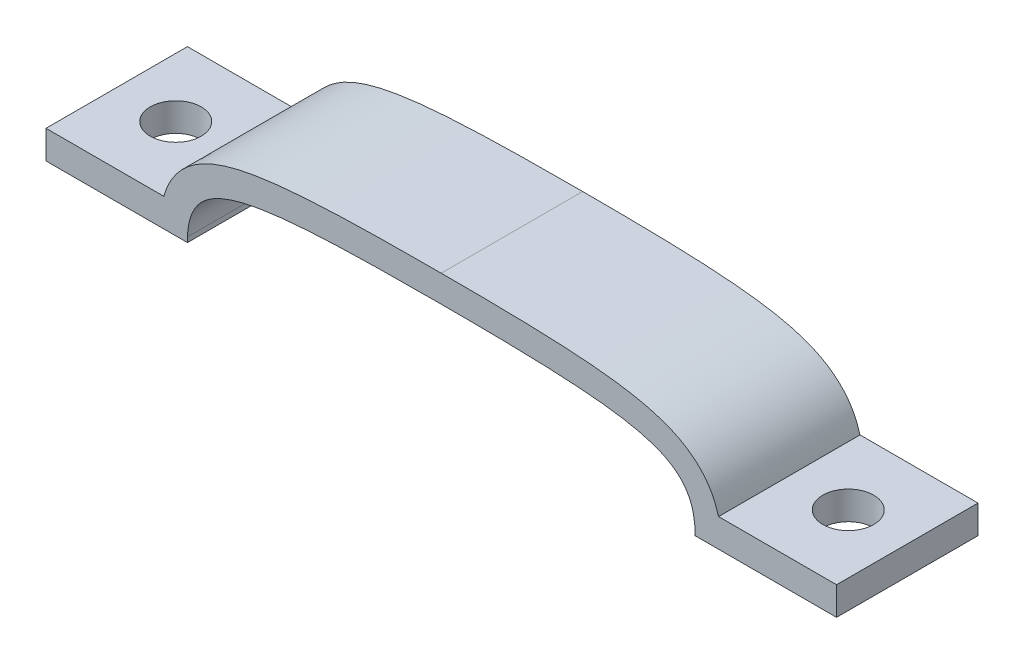
from build123d import *

# Parameters (mm, degrees)
BOSS_EXTRUDE1_DEPTH  = 10
M3_CLEARANCE_HOLE1_D = 3.6


with BuildPart() as part:
    # Sketch1 → Boss-Extrude1 (new body)
    with BuildSketch(Plane.XY):
        with BuildLine():
            Line((-60.071865843, 158.086868585), (-60.071865843, 158.433944586))
            add(Edge.make_bspline(
                [(-42.129226337, 163.286859626), (-43.810516811, 163.286860342), (-46.346669536, 163.273840815), (-49.670813728, 163.182542922), (-52.157685802, 163.050705666), (-54.633540161, 162.800940146), (-56.687823673, 162.397641303), (-58.265533161, 161.746859791), (-59.321589807, 160.931865013), (-59.947005957, 159.721222926), (-60.052734865, 158.863750442), (-60.071865843, 158.433944586)],
                knots=[0.500001245, 0.500001245, 0.500001245, 0.500001245, 0.562726434, 0.594089029, 0.625451624, 0.656814219, 0.688176814, 0.703858111, 0.719539409, 0.735220706, 0.750902004, 0.750902004, 0.750902004, 0.750902004], degree=3))
            add(Edge.make_bspline(
                [(-24.179226419, 158.086868585), (-24.17922642, 158.52341786), (-24.235684401, 159.39201048), (-24.738163757, 160.685431171), (-25.761907783, 161.618567296), (-26.968792465, 162.167965525), (-28.219863194, 162.51977654), (-29.913292178, 162.830153249), (-32.039454707, 163.046674526), (-34.586679577, 163.183060856), (-37.120592622, 163.251933888), (-39.640089694, 163.282196609), (-41.297668845, 163.286859645), (-42.129226426, 163.286859626)],
                knots=[0.755163082, 0.755163082, 0.755163082, 0.755163082, 0.77046539, 0.785767697, 0.801070004, 0.816372312, 0.831674619, 0.846976926, 0.877581541, 0.908186156, 0.938790771, 0.969395385, 1, 1, 1, 1], degree=3))
            Line((-24.179226419, 158.086868585), (-14.179226419, 158.086868585))
            Line((-14.179226419, 158.086868585), (-14.179226419, 160.086868585))
            Line((-14.179226419, 160.086868585), (-22.520839316, 160.086868585))
            add(Edge.make_bspline(
                [(-22.520839316, 160.086868585), (-22.542398925, 160.165792032), (-22.607754881, 160.387078464), (-22.804535541, 160.930325251), (-23.22358028, 161.725143028), (-23.947982988, 162.553558881), (-25.005259277, 163.370103577), (-26.347129003, 163.971682922), (-27.802457078, 164.375196309), (-29.206218405, 164.632537516), (-30.56094003, 164.805515449), (-32.338448656, 164.966218974), (-34.514502554, 165.081677345), (-37.085705755, 165.151738274), (-39.62785294, 165.182162424), (-41.292958253, 165.186859644), (-42.129225527, 165.186859626)],
                knots=[0.772781141, 0.772781141, 0.772781141, 0.772781141, 0.77469393, 0.778116543, 0.785767697, 0.793418851, 0.801070004, 0.816372312, 0.831674619, 0.846976926, 0.862279234, 0.877581541, 0.908186156, 0.938790771, 0.969395385, 0.999999989, 0.999999989, 0.999999989, 0.999999989], degree=3))
            add(Edge.make_bspline(
                [(-42.129225527, 165.186859626), (-42.977807037, 165.186859988), (-44.678224484, 165.181933225), (-47.209231367, 165.150882075), (-49.74192012, 165.081555264), (-52.291038411, 164.945937503), (-54.455080713, 164.731497457), (-56.255120817, 164.418028105), (-57.665212852, 164.04941281), (-59.182648793, 163.43388964), (-60.511128599, 162.437445588), (-61.327648426, 161.2280062), (-61.606787874, 160.536587134), (-61.716531582, 160.164036641), (-61.737611418, 160.086868585)],
                knots=[0.500001245, 0.500001245, 0.500001245, 0.500001245, 0.531356832, 0.562712419, 0.594068006, 0.625423593, 0.65677918, 0.672456974, 0.688134768, 0.703812561, 0.719490355, 0.727329251, 0.73479101, 0.736750735, 0.736750735, 0.736750735, 0.736750735], degree=3))
            Line((-61.737611418, 160.086868585), (-70.071865843, 160.086868585))
            Line((-70.071865843, 160.086868585), (-70.071865843, 158.086868585))
            Line((-70.071865843, 158.086868585), (-60.071865843, 158.086868585))
        make_face()
    extrude(amount=BOSS_EXTRUDE1_DEPTH)

    # M3 Clearance Hole1 (through all)
    with Locations(Plane(origin=(0, 158.086868585, 0), x_dir=(-1, 0, 0), z_dir=(0, -1, 0))):
        with Locations((18.350032933, -5), (65.90105946, -5)):
            Hole(M3_CLEARANCE_HOLE1_D / 2)


solid = part.part
